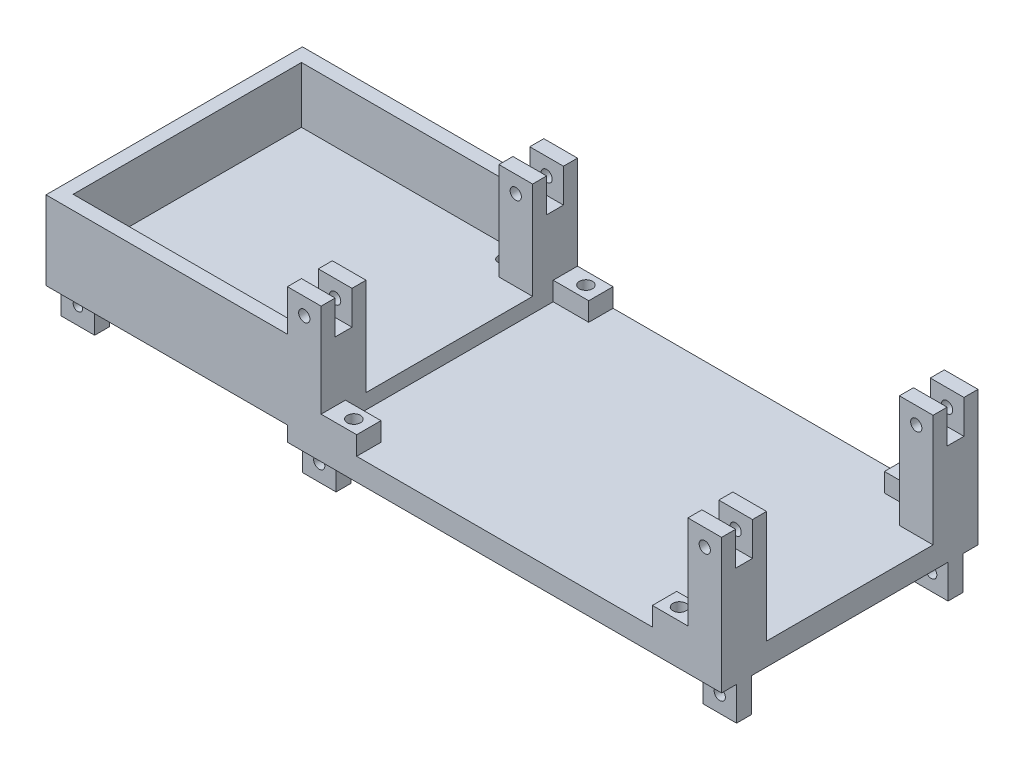
from build123d import *

# Parameters (mm, degrees)
SKETCH1_W            = 116
SKETCH1_H            = 34.25
BOSS_EXTRUDE2_DEPTH  = 6
SKETCH3_W            = 9
SKETCH3_H            = 4
BOSS_EXTRUDE3_DEPTH  = 9
SKETCH4_R            = 1.5
CUT_EXTRUDE1_DEPTH   = 121.216731365
SKETCH5_W            = 9
SKETCH5_H            = 12
BOSS_EXTRUDE4_DEPTH  = 30
SKETCH6_W            = 9
SKETCH6_H            = 4.5
CUT_EXTRUDE2_DEPTH   = 9
SKETCH7_R            = 1.5
CUT_EXTRUDE3_DEPTH   = 12
SKETCH8_R            = 1.75
CUT_EXTRUDE4_DEPTH   = 125.615659128
BOSS_EXTRUDE5_START  = 5
SKETCH9_W            = 9.5
SKETCH9_H            = 6.5
SKETCH9_R            = 1.75
BOSS_EXTRUDE5_DEPTH  = 5
SKETCH10_W           = 9
SKETCH10_H           = 44.5
BOSS_EXTRUDE6_DEPTH  = 4
SKETCH11_W           = 68.5
SKETCH11_H           = 6
BOSS_EXTRUDE7_DEPTH  = 64.5
BOSS_EXTRUDE8_DEPTH  = 15
BOSS_EXTRUDE9_DEPTH  = 56
SKETCH14_W           = 9
SKETCH14_H           = 4
BOSS_EXTRUDE10_DEPTH = 9
SKETCH15_R           = 1.25
CUT_EXTRUDE5_DEPTH   = 196.02948495
CUT_EXTRUDE6_DEPTH   = 13
SKETCH17_R           = 1.5
CUT_EXTRUDE7_DEPTH   = 195.803747397


with BuildPart() as part:
    # Sketch1 → Boss-Extrude2 (new body)
    with BuildSketch(Plane(origin=(0, 0, 0), x_dir=(1, 0, 0), z_dir=(0, 1, 0))):
        with Locations((-58, 17.125)):
            Rectangle(SKETCH1_W, SKETCH1_H)
    boss_extrude2 = extrude(amount=BOSS_EXTRUDE2_DEPTH)

    # Sketch3 → Boss-Extrude3 (add)
    with BuildSketch(Plane.XZ):
        with Locations((-111.5, -6)):
            Rectangle(SKETCH3_W, SKETCH3_H)
        with Locations((-4.5, -6)):
            Rectangle(SKETCH3_W, SKETCH3_H)
    boss_extrude3 = extrude(amount=BOSS_EXTRUDE3_DEPTH)

    # Sketch4 → Cut-Extrude1 (cut, through all)
    with BuildSketch(Plane.XY.offset(-4)):
        with Locations((-111.5, -4.5)):
            Circle(SKETCH4_R)
        with Locations((-4.5, -4.5)):
            Circle(SKETCH4_R)
    cut_extrude1 = extrude(amount=-CUT_EXTRUDE1_DEPTH, mode=Mode.SUBTRACT)

    # Sketch5 → Boss-Extrude4 (add)
    with BuildSketch(Plane(origin=(0, 6, 0), x_dir=(1, 0, 0), z_dir=(0, 1, 0))):
        with Locations((-111.5, 6)):
            Rectangle(SKETCH5_W, SKETCH5_H)
        with Locations((-4.5, 6)):
            Rectangle(SKETCH5_W, SKETCH5_H)
    boss_extrude4 = extrude(amount=BOSS_EXTRUDE4_DEPTH)

    # Sketch6 → Cut-Extrude2 (cut)
    with BuildSketch(Plane(origin=(0, 36, 0), x_dir=(1, 0, 0), z_dir=(0, 1, 0))):
        with Locations((-111.5, 6)):
            Rectangle(SKETCH6_W, SKETCH6_H)
        with Locations((-4.5, 6)):
            Rectangle(SKETCH6_W, SKETCH6_H)
    cut_extrude2 = extrude(amount=-CUT_EXTRUDE2_DEPTH, mode=Mode.SUBTRACT)

    # Sketch7 → Cut-Extrude3 (cut)
    with BuildSketch(Plane.XY):
        with Locations((-111.5, 31.5)):
            Circle(SKETCH7_R)
        with Locations((-4.5, 31.5)):
            Circle(SKETCH7_R)
    cut_extrude3 = extrude(amount=-CUT_EXTRUDE3_DEPTH, mode=Mode.SUBTRACT)

    # Sketch8 → Cut-Extrude4 (cut, through all)
    with BuildSketch(Plane(origin=(0, 6, 0), x_dir=(1, 0, 0), z_dir=(0, 1, 0))):
        with Locations((-14.5, 3.25)):
            Circle(SKETCH8_R)
        with Locations((-101.5, 3.25)):
            Circle(SKETCH8_R)
    cut_extrude4 = extrude(amount=-CUT_EXTRUDE4_DEPTH, mode=Mode.SUBTRACT)

    # Sketch9 → Boss-Extrude5 (add)
    # profile 1 of 2: a face of its own
    with BuildSketch(Plane(origin=(0, 6, 0), x_dir=(1, 0, 0), z_dir=(0, 1, 0)).offset(BOSS_EXTRUDE5_START)):
        with Locations((-102.25, 3.25)):
            Rectangle(SKETCH9_W, SKETCH9_H)
        with Locations((-101.5, 3.25)):
            Circle(SKETCH9_R, mode=Mode.SUBTRACT)
    # profile 2 of 2: a face of its own
    with BuildSketch(Plane(origin=(0, 6, 0), x_dir=(1, 0, 0), z_dir=(0, 1, 0)).offset(BOSS_EXTRUDE5_START)):
        with Locations((-13.75, 3.25)):
            Rectangle(SKETCH9_W, SKETCH9_H)
        with Locations((-14.5, 3.25)):
            Circle(SKETCH9_R, mode=Mode.SUBTRACT)
    boss_extrude5 = extrude(amount=-BOSS_EXTRUDE5_DEPTH)

    # Mirror1: Boss-Extrude2, Boss-Extrude3, Cut-Extrude1, Boss-Extrude4, Cut-Extrude2, Cut-Extrude3, Cut-Extrude4, Boss-Extrude5 across plane
    add(boss_extrude2.mirror(Plane(origin=(0, 6, -34.25), x_dir=(1, 0, 0), z_dir=(0, 0, 1))))
    add(boss_extrude3.mirror(Plane(origin=(0, 6, -34.25), x_dir=(1, 0, 0), z_dir=(0, 0, 1))))
    add(cut_extrude1.mirror(Plane(origin=(0, 6, -34.25), x_dir=(1, 0, 0), z_dir=(0, 0, 1))), mode=Mode.SUBTRACT)
    add(boss_extrude4.mirror(Plane(origin=(0, 6, -34.25), x_dir=(1, 0, 0), z_dir=(0, 0, 1))))
    add(cut_extrude2.mirror(Plane(origin=(0, 6, -34.25), x_dir=(1, 0, 0), z_dir=(0, 0, 1))), mode=Mode.SUBTRACT)
    add(cut_extrude3.mirror(Plane(origin=(0, 6, -34.25), x_dir=(1, 0, 0), z_dir=(0, 0, 1))), mode=Mode.SUBTRACT)
    add(cut_extrude4.mirror(Plane(origin=(0, 6, -34.25), x_dir=(1, 0, 0), z_dir=(0, 0, 1))), mode=Mode.SUBTRACT)
    add(boss_extrude5.mirror(Plane(origin=(0, 6, -34.25), x_dir=(1, 0, 0), z_dir=(0, 0, 1))))

    # Sketch10 → Boss-Extrude6 (add)
    with BuildSketch(Plane(origin=(0, 6, 0), x_dir=(1, 0, 0), z_dir=(0, 1, 0))):
        with Locations((-111.5, 34.25)):
            Rectangle(SKETCH10_W, SKETCH10_H)
    extrude(amount=BOSS_EXTRUDE6_DEPTH)

    # Sketch11 → Boss-Extrude7 (add)
    with BuildSketch(Plane.ZY.offset(116)):
        with Locations((-34.25, 7)):
            Rectangle(SKETCH11_W, SKETCH11_H)
    extrude(amount=BOSS_EXTRUDE7_DEPTH)

    # Sketch12 → Boss-Extrude8 (add)
    with BuildSketch(Plane(origin=(0, 10, 0), x_dir=(1, 0, 0), z_dir=(0, 1, 0))):
        Polygon((-116, 68.5), (-116, 64.75), (-177, 64.75), (-177, 3.75), (-116, 3.75), (-116, 0), (-180.5, 0), (-180.5, 68.5), align=None)
    extrude(amount=BOSS_EXTRUDE8_DEPTH)

    # Sketch13 → Boss-Extrude9 (add)
    with BuildSketch(Plane.XY):
        Polygon((-116, 0), (-116, 4), (-128, 4), align=None)
    extrude(amount=-BOSS_EXTRUDE9_DEPTH)

    # Sketch14 → Boss-Extrude10 (add)
    with BuildSketch(Plane.XZ.offset(-4)):
        with Locations((-176, -6)):
            Rectangle(SKETCH14_W, SKETCH14_H)
        with Locations((-176, -62.5)):
            Rectangle(SKETCH14_W, SKETCH14_H)
    extrude(amount=BOSS_EXTRUDE10_DEPTH)

    # Sketch15 → Cut-Extrude5 (cut, through all)
    with BuildSketch(Plane(origin=(0, 0, -64.5), x_dir=(-1, 0, 0), z_dir=(0, 0, -1))):
        with Locations((176, -0.5)):
            Circle(SKETCH15_R)
    extrude(amount=-CUT_EXTRUDE5_DEPTH, mode=Mode.SUBTRACT)

    # Sketch16 → Cut-Extrude6 (cut)
    with BuildSketch(Plane.XY):
        Polygon((-116, 0), (-128, 4), (-116, 4), align=None)
    extrude(amount=-CUT_EXTRUDE6_DEPTH, mode=Mode.SUBTRACT)

    # Sketch17 → Cut-Extrude7 (cut, through all)
    with BuildSketch(Plane(origin=(0, 10, 0), x_dir=(1, 0, 0), z_dir=(0, 1, 0))):
        with Locations((-119.5, 61.25)):
            Circle(SKETCH17_R)
        with Locations((-119.5, 7.25)):
            Circle(SKETCH17_R)
    extrude(amount=-CUT_EXTRUDE7_DEPTH, mode=Mode.SUBTRACT)


solid = part.part
